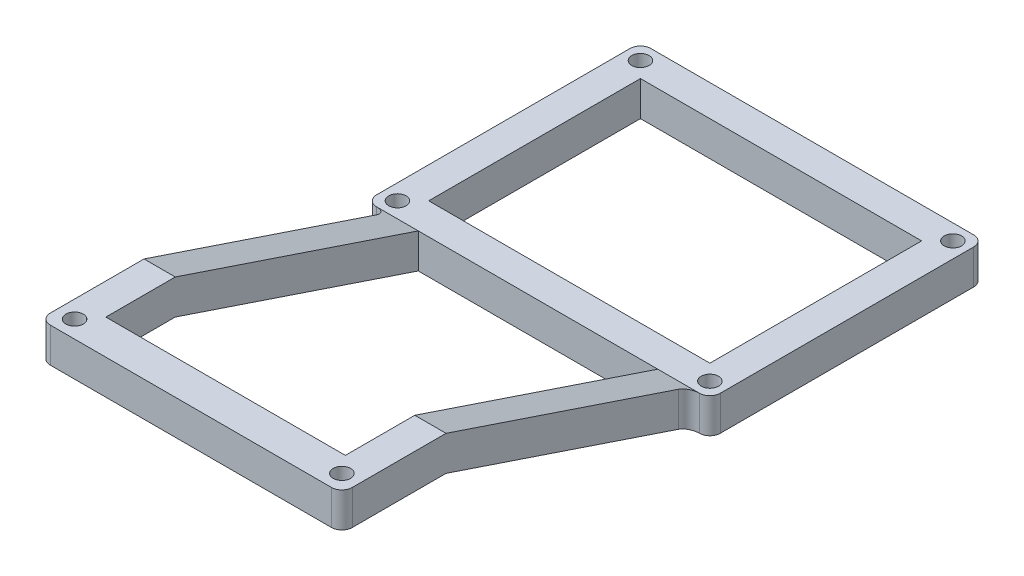
from build123d import *

# Parameters (mm, degrees)
SKETCH_1_W          = 99
SKETCH_1_H          = 79
SKETCH_1_R          = 2.5
SKETCH_1_W_2        = 81
SKETCH_1_H_2        = 61
EXTRUDE_1_DEPTH     = 10
EXTRUDE_2_DEPTH     = 15
CUT_EXTRUDE_1_DEPTH = 6
EXTRUDE_3_REACH     = 202.547
SKETCH_7_W          = 10
SKETCH_7_H          = 10
SKETCH_8_R          = 2.5
CUT_EXTRUDE_2_DEPTH = 206.898640112
FILLET_1_R          = 3


with BuildPart() as part:
    # 草图1 → 凸台-拉伸1 (new body)
    with BuildSketch(Plane(origin=(0, 0, 0), x_dir=(1, 0, 0), z_dir=(0, 1, 0))):
        with Locations((49.5, -39.5)):
            Rectangle(SKETCH_1_W, SKETCH_1_H)
        with Locations(Location((94.5, -4.5, 0), (0, 0, 270))):
            Circle(SKETCH_1_R, mode=Mode.SUBTRACT)
        with Locations(Location((4.5, -4.5, 0), (0, 0, 270))):
            Circle(SKETCH_1_R, mode=Mode.SUBTRACT)
        with Locations(Location((4.5, -74.5, 0), (0, 0, 270))):
            Circle(SKETCH_1_R, mode=Mode.SUBTRACT)
        with Locations(Location((94.5, -74.5, 0), (0, 0, 270))):
            Circle(SKETCH_1_R, mode=Mode.SUBTRACT)
        with Locations((49.5, -39.5)):
            Rectangle(SKETCH_1_W_2, SKETCH_1_H_2, mode=Mode.SUBTRACT)
    extrude(amount=EXTRUDE_1_DEPTH)

    # 草图4 → 凸台-拉伸2 (add)
    with BuildSketch(Plane(origin=(99, 0, 0), x_dir=(0, 0, -1), z_dir=(1, 0, 0))):
        Polygon((-79, 0), (-149, 23.5), (-179, 23.5), (-179, 33.5), (-149, 33.5), (-79, 10), align=None)
    extrude_2 = extrude(amount=-EXTRUDE_2_DEPTH)

    # 镜向1: 凸台-拉伸2 across plane
    add(extrude_2.mirror(Plane.ZY.offset(-49.5)))

    # 草图4<2> → 切除-拉伸1 (cut)
    with BuildSketch(Plane(origin=(99, 0, 0), x_dir=(0, 0, -1), z_dir=(1, 0, 0))):
        Polygon((-79, 0), (-149, 23.5), (-179, 23.5), (-179, 33.5), (-149, 33.5), (-79, 10), align=None)
    cut_extrude_1 = extrude(amount=-CUT_EXTRUDE_1_DEPTH, mode=Mode.SUBTRACT)

    # 镜向2: 切除-拉伸1 across plane
    add(cut_extrude_1.mirror(Plane.ZY.offset(-49.5)), mode=Mode.SUBTRACT)

    # 草图7 → 凸台-拉伸3 (add, up to next)
    with BuildSketch(Plane.ZY.offset(-84), mode=Mode.PRIVATE) as extrude_3_sk1:
        with Locations((174, 28.5)):
            Rectangle(SKETCH_7_W, SKETCH_7_H)
    extrude_3_tool1 = extrude(extrude_3_sk1.sketch, amount=EXTRUDE_3_REACH, mode=Mode.PRIVATE) - part.part
    add(extrude_3_tool1.solids().sort_by_distance((84, 28.5, 174))[0])

    # 草图8 → 切除-拉伸2 (cut, through all)
    with BuildSketch(Plane.XZ.offset(-23.5)):
        with Locations(Location((88, 174, 0), (0, 0, 270))):
            Circle(SKETCH_8_R)
        with Locations(Location((11, 174, 0), (0, 0, 270))):
            Circle(SKETCH_8_R)
    extrude(amount=-CUT_EXTRUDE_2_DEPTH, mode=Mode.SUBTRACT)

    # 圆角1
    fillet_1_edges = [part.edges().sort_by_distance(p)[0] for p in [
        (0, 5, 79),
        (6, 5, 79),
        (6, 28.5, 179),
        (0, 5, 0),
        (99, 5, 0),
        (93, 5, 79),
        (93, 28.5, 179),
        (99, 5, 79),
    ]]
    fillet(fillet_1_edges, radius=FILLET_1_R - 0.0001)  # a hair under: the kernel refuses the full size


solid = part.part
